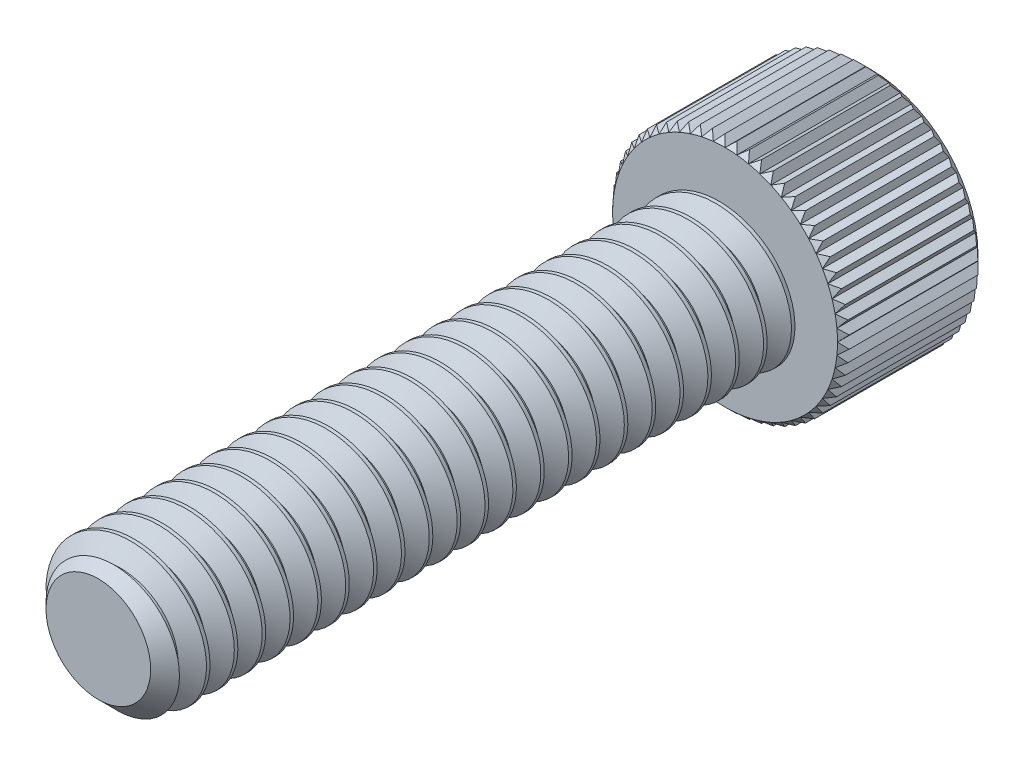
from build123d import *
from build123d.topology import SkipClean

# Parameters (mm, degrees)
SKETCH1_R          = 0.9271
EXTRUDE1_DEPTH     = 7.9375
CHAMFER3_SIZE      = 0.264583333
CUT_SWEEP1_PITCH   = 0.352777778
SKETCH6_R          = 1.4986
EXTRUDE2_DEPTH     = 1.8542
CUT_EXTRUDE1_DEPTH = 1.190625
CHAMFER1_SIZE      = 0.14986
CHAMFER2_SIZE      = 0.07493
CUT_EXTRUDE3_DEPTH = 9.215565212
CIRPATTERN1_COUNT  = 60


with BuildPart() as part:
    # Sketch1 → Extrude1 (new body)
    with BuildSketch(Plane.XY):
        Circle(SKETCH1_R)
    extrude(amount=-EXTRUDE1_DEPTH)

    # Chamfer3
    chamfer3_edges = [part.edges().sort_by_distance(p)[0] for p in [
        (-0.9271, 0, 0),
    ]]
    chamfer(chamfer3_edges, length=CHAMFER3_SIZE)

    # Cut-Sweep1: arcs per turn and ends read off the stored shape
    # Cut-Sweep1: the profile of Sketch3 profile screwed along a right-hand helix through 24 turns, 6 arcs to a turn; built about Z, then put on its axis
    cut_sweep1_z = Axis((0, 0, 0), (0, 0, 1))
    cut_sweep1_corners = [(0.9274, 0, -0.308853761), (0.697964112, 0, -0.176388889), (0.697964112, 0, -0.132291667), (0.9274, 0, 0.000173205)]
    with BuildLine(mode=Mode.PRIVATE) as cut_sweep1_profile:
        Line(cut_sweep1_corners[0], cut_sweep1_corners[1])
        Line(cut_sweep1_corners[1], cut_sweep1_corners[2])
        Line(cut_sweep1_corners[2], cut_sweep1_corners[3])
        Line(cut_sweep1_corners[3], cut_sweep1_corners[0])
    cut_sweep1_cap = Face(cut_sweep1_profile.wire())
    cut_sweep1_turn_angles = [0, 30, 60, 90, 120, 150, 180, 210, 240, 270, 300, 330, 360]
    cut_sweep1_turn_weights = [1, 0.8660254037844387, 1, 0.8660254037844387, 1, 0.8660254037844387, 1, 0.8660254037844387, 1, 0.8660254037844387, 1, 0.8660254037844387, 1]
    cut_sweep1_turn_rails = [Edge.make_bspline([Vector(p[0], p[1], 0).rotate(cut_sweep1_z, cut_sweep1_turn_angles[k]) / cut_sweep1_turn_weights[k] + Vector(0, 0, p[2] + CUT_SWEEP1_PITCH * cut_sweep1_turn_angles[k] / 360) for k in range(13)], [0, 0, 0, 1, 1, 2, 2, 3, 3, 4, 4, 5, 5, 6, 6, 6], 2, cut_sweep1_turn_weights) for p in cut_sweep1_corners]
    cut_sweep1_turn_sides = [Face.make_surface_from_curves(cut_sweep1_turn_rails[p[0]], cut_sweep1_turn_rails[p[1]]) for p in [(0, 1), (1, 2), (2, 3), (3, 0)]]
    cut_sweep1 = Plane(origin=(0, 0, 0), x_dir=(0, 1, 0), z_dir=(0, 0, -1)) * Solid(Shell([*[p.moved(Location((0, 0, CUT_SWEEP1_PITCH * i))) for i in range(24) for p in cut_sweep1_turn_sides], cut_sweep1_cap, cut_sweep1_cap.rotate(cut_sweep1_z, 8640).moved(Location((0, 0, CUT_SWEEP1_PITCH * 8640 / 360)))]))
    add(cut_sweep1, mode=Mode.SUBTRACT)

    # Sketch6 → Extrude2 (add)
    with BuildSketch(Plane(origin=(0, 0, -7.9375), x_dir=(-1, 0, 0), z_dir=(0, 0, -1))):
        Circle(SKETCH6_R)
    extrude(amount=EXTRUDE2_DEPTH)

    # Sketch7 → Cut-Extrude1 (cut)
    with BuildSketch(Plane(origin=(0, 0, -9.7917), x_dir=(-1, 0, 0), z_dir=(0, 0, -1))):
        Polygon((0, 0.916543552), (-0.79375, 0.458271776), (-0.79375, -0.458271776), (0, -0.916543552), (0.79375, -0.458271776), (0.79375, 0.458271776), align=None)
    extrude(amount=-CUT_EXTRUDE1_DEPTH, mode=Mode.SUBTRACT)

    # Cut-Extrude2 cone 1 section (through the dimple's axis) → Cut-Extrude2 (revolve, cut)
    with BuildSketch(Plane(origin=(0, 0, -9.7917), x_dir=(0, 1, 0), z_dir=(1, 0, 0))):
        Polygon((0, 0), (0.916543552, 0), (0, 0.916543552), align=None)
    revolve(axis=Axis((0, 0, -9.7917), (0, 0, 1)), mode=Mode.SUBTRACT)

    # Chamfer1
    chamfer1_edges = [part.edges().sort_by_distance(p)[0] for p in [
        (1.4986, 0, -9.7917),
    ]]
    chamfer(chamfer1_edges, length=CHAMFER1_SIZE)

    # Chamfer2
    chamfer2_edges = [part.edges().sort_by_distance(p)[0] for p in [
        (1.4986, 0, -7.9375),
    ]]
    chamfer(chamfer2_edges, length=CHAMFER2_SIZE)

    # Sketch10 → Cut-Extrude3 (cut, through all)
    with SkipClean():  # the faces are left unmerged after this step: merging them gives an invalid solid
        with BuildSketch(Plane.XY.offset(-7.9375)):
            Polygon((-0.161281954, 1.57353), (0, 1.42367), (0.161281954, 1.57353), align=None)
        cut_extrude3 = extrude(amount=-CUT_EXTRUDE3_DEPTH, mode=Mode.SUBTRACT)

    # CirPattern1: Cut-Extrude3 ×60 about axis
    cirpattern1_axis = Axis((0, 0, 0), (0, 0, 1))
    for i in range(1, CIRPATTERN1_COUNT):
        add(cut_extrude3.rotate(cirpattern1_axis, i * 360 / CIRPATTERN1_COUNT), mode=Mode.SUBTRACT)


solid = part.part
